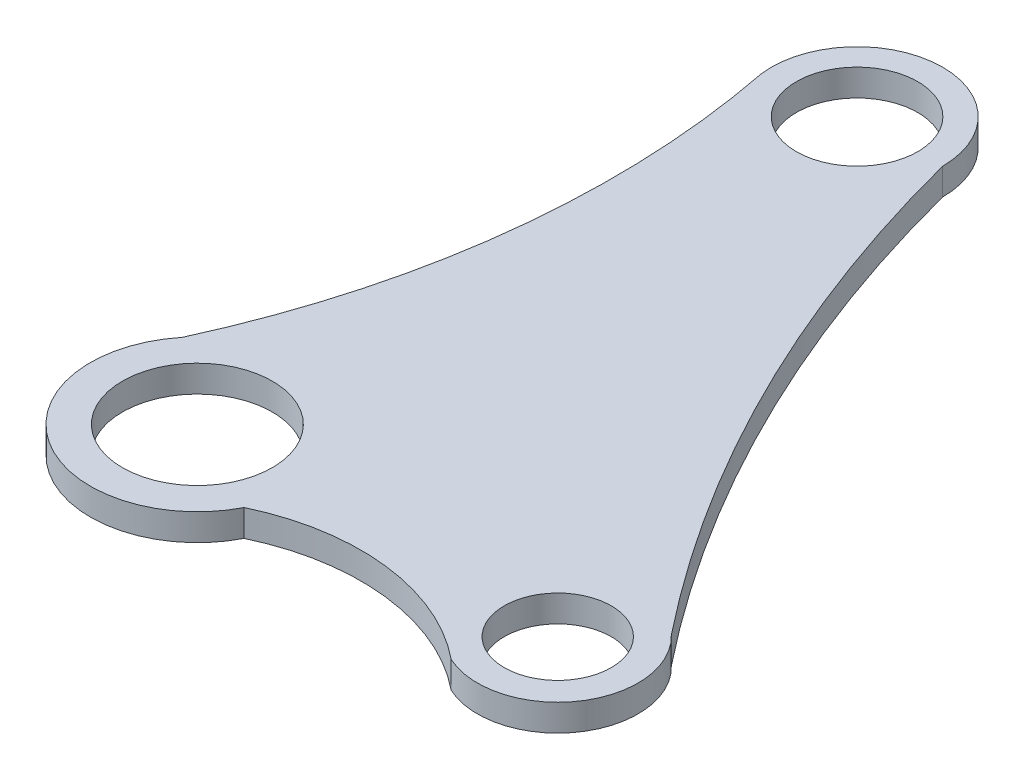
from build123d import *

# Parameters (mm, degrees)
SKETCH1_R           = 8.89
SKETCH1_R_2         = 7.199480632
SKETCH1_R_3         = 6.35
BOSS_EXTRUDE1_DEPTH = 3.175


with BuildPart() as part:
    # Sketch1 → Boss-Extrude1 (new body)
    with BuildSketch(Plane(origin=(0, 0, 0), x_dir=(1, 0, 0), z_dir=(0, 1, 0))):
        with BuildLine():
            ThreePointArc((-9.841918443, 8.026620793), (-6.935406174, -10.639085544), (11.315790364, -5.765664614))
            ThreePointArc((11.315790364, -5.765664614), (25.740249478, -3.394175266), (39.201170074, -9.094403262))
            ThreePointArc((39.201170074, -9.094403262), (51.059511196, -5.787458182), (49.751485572, 6.453669581))
            ThreePointArc((49.751485572, 6.453669581), (30.344153641, 36.906923092), (17.672267645, 70.722133981))
            ThreePointArc((17.672267645, 70.722133981), (6.885154889, 80.862761653), (-2.57031692, 69.47029993))
            ThreePointArc((-2.57031692, 69.47029993), (-1.367421511, 38.17582098), (-9.841918443, 8.026620793))
        make_face()
        Circle(SKETCH1_R, mode=Mode.SUBTRACT)
        with Locations((7.512267645, 70.722133981)):
            Circle(SKETCH1_R_2, mode=Mode.SUBTRACT)
        with Locations((43.17776617, -0.439213577)):
            Circle(SKETCH1_R_3, mode=Mode.SUBTRACT)
    extrude(amount=BOSS_EXTRUDE1_DEPTH)


solid = part.part
